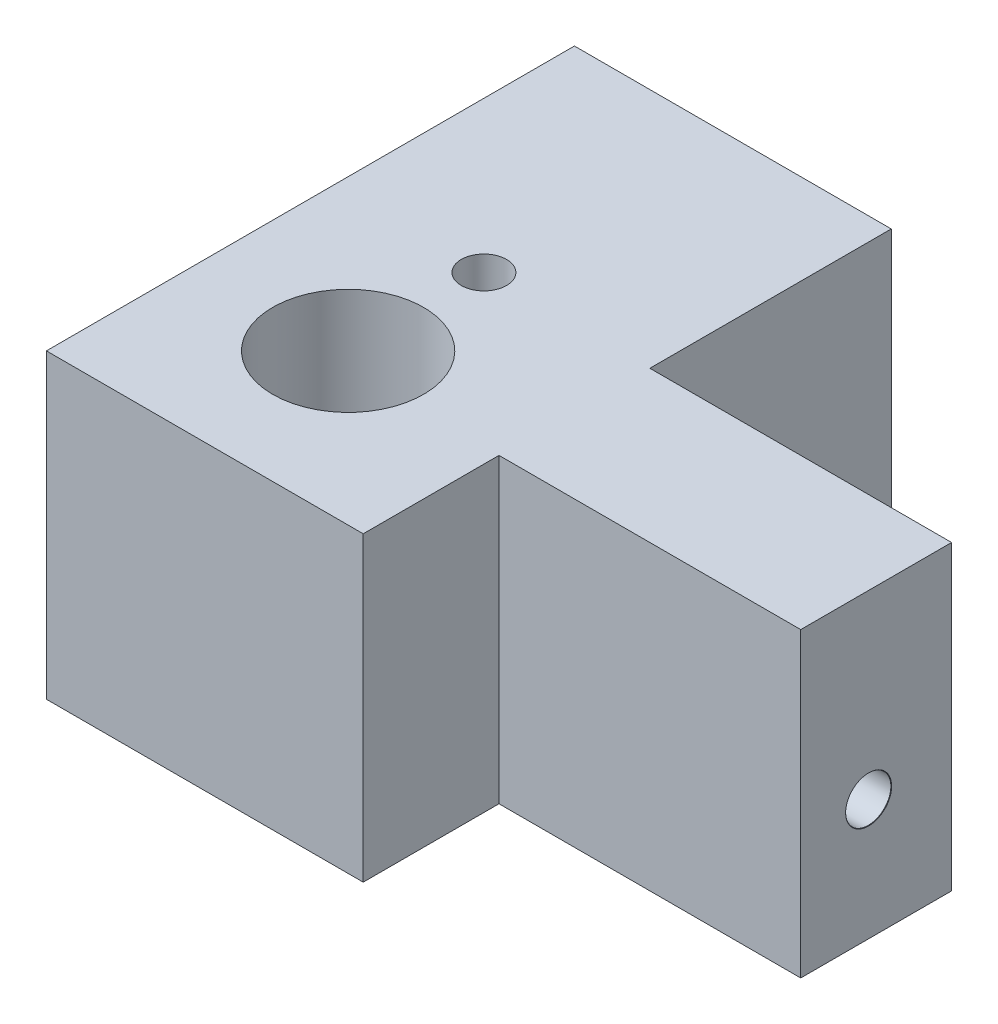
from build123d import *

# Parameters (mm, degrees)
SKETCH1_W                       = 49
SKETCH1_H                       = 35
BOSS_EXTRUDE1_DEPTH             = 20
F_3_0MM_DOWEL_HOLE1_D           = 3
F_3_0MM_DOWEL_HOLE1_DEPTH       = 11.098709071
F_3_0MM_DOWEL_HOLE1_CSINK_D     = 3.05
F_3_0MM_DOWEL_HOLE1_CSINK_ANGLE = 90
F_3_0MM_DOWEL_HOLE1_TIP         = 0.901290929
F_3_0MM_DOWEL_HOLE2_D           = 3
F_3_0MM_DOWEL_HOLE2_DEPTH       = 12
F_3_0MM_DOWEL_HOLE2_CSINK_D     = 3.05
F_3_0MM_DOWEL_HOLE2_CSINK_ANGLE = 90
F_3_0MM_DOWEL_HOLE2_TIP         = 0.901290929
F_3_0MM_DOWEL_HOLE3_D           = 3
F_3_0MM_DOWEL_HOLE3_CSINK_D     = 3.05
F_3_0MM_DOWEL_HOLE3_CSINK_ANGLE = 90
SKETCH14_W                      = 8
SKETCH14_H                      = 35
SKETCH14_W_2                    = 20
SKETCH14_H_2                    = 16
SKETCH14_H_3                    = 9
CUT_EXTRUDE3_DEPTH              = 28
SKETCH15_R                      = 5
CUT_EXTRUDE4_DEPTH              = 30


with BuildPart() as part:
    # Sketch1 → Boss-Extrude1 (new body)
    with BuildSketch(Plane(origin=(0, 0, 0), x_dir=(1, 0, 0), z_dir=(0, 1, 0))):
        with Locations((13.974428044, 4.809594096)):
            Rectangle(SKETCH1_W, SKETCH1_H)
    extrude(amount=BOSS_EXTRUDE1_DEPTH)

    # Ø3.0mm Dowel Hole1
    with Locations(Plane(origin=(0, 0, -22.309594096), x_dir=(-1, 0, 0), z_dir=(0, 0, -1))):
        with Locations((-7.474428044, 16)):
            CounterSinkHole(F_3_0MM_DOWEL_HOLE1_D / 2, F_3_0MM_DOWEL_HOLE1_CSINK_D / 2, depth=F_3_0MM_DOWEL_HOLE1_DEPTH, counter_sink_angle=F_3_0MM_DOWEL_HOLE1_CSINK_ANGLE)
            with Locations((0, 0, -(F_3_0MM_DOWEL_HOLE1_DEPTH + F_3_0MM_DOWEL_HOLE1_TIP / 2))):  # 118° drill point
                Cone(0, F_3_0MM_DOWEL_HOLE1_D / 2, F_3_0MM_DOWEL_HOLE1_TIP, mode=Mode.SUBTRACT)

    # Ø3.0mm Dowel Hole2
    with Locations(Plane(origin=(38.474428044, 0, 0), x_dir=(0, 0, -1), z_dir=(1, 0, 0))):
        with Locations((0.809594096, 8)):
            CounterSinkHole(F_3_0MM_DOWEL_HOLE2_D / 2, F_3_0MM_DOWEL_HOLE2_CSINK_D / 2, depth=F_3_0MM_DOWEL_HOLE2_DEPTH, counter_sink_angle=F_3_0MM_DOWEL_HOLE2_CSINK_ANGLE)
            with Locations((0, 0, -(F_3_0MM_DOWEL_HOLE2_DEPTH + F_3_0MM_DOWEL_HOLE2_TIP / 2))):  # 118° drill point
                Cone(0, F_3_0MM_DOWEL_HOLE2_D / 2, F_3_0MM_DOWEL_HOLE2_TIP, mode=Mode.SUBTRACT)

    # Ø3.0mm Dowel Hole3 (through all)
    with Locations(Plane(origin=(0, 0, 0), x_dir=(-1, 0, 0), z_dir=(0, -1, 0))):
        with Locations((-7.474428044, 6.309594096)):
            CounterSinkHole(F_3_0MM_DOWEL_HOLE3_D / 2, F_3_0MM_DOWEL_HOLE3_CSINK_D / 2, counter_sink_angle=F_3_0MM_DOWEL_HOLE3_CSINK_ANGLE)

    # Sketch14 → Cut-Extrude3 (cut)
    with BuildSketch(Plane(origin=(0, 20, 0), x_dir=(1, 0, 0), z_dir=(0, 1, 0))):
        with Locations((-6.525571956, 4.809594096)):
            Rectangle(SKETCH14_W, SKETCH14_H)
        with Locations((28.474428044, 14.309594096)):
            Rectangle(SKETCH14_W_2, SKETCH14_H_2)
        with Locations((28.474428044, -8.190405904)):
            Rectangle(SKETCH14_W_2, SKETCH14_H_3)
    extrude(amount=-CUT_EXTRUDE3_DEPTH, mode=Mode.SUBTRACT)

    # Sketch15 → Cut-Extrude4 (cut)
    with BuildSketch(Plane(origin=(0, 20, 0), x_dir=(1, 0, 0), z_dir=(0, 1, 0))):
        with Locations((7.474428044, -2.690405904)):
            Circle(SKETCH15_R)
    extrude(amount=-CUT_EXTRUDE4_DEPTH, mode=Mode.SUBTRACT)


solid = part.part
